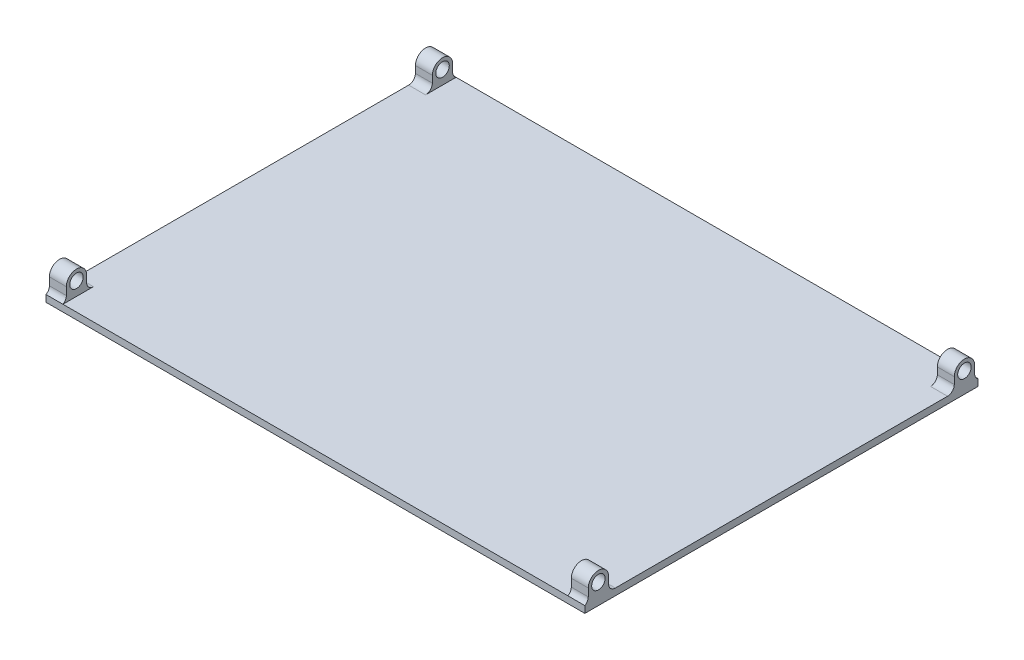
from build123d import *

# Parameters (mm, degrees)
SKETCH_1_W          = 159
SKETCH_1_H          = 116
EXTRUDE_1_DEPTH     = 2
SKETCH_3_R          = 1.99
EXTRUDE_3_DEPTH     = 79.5
SKETCH_4_W          = 149
SKETCH_4_H          = 7
CUT_EXTRUDE_2_DEPTH = 79.5
FILLET_3_R          = 2


with BuildPart() as part:
    # 草图1 → 凸台-拉伸1 (new body)
    with BuildSketch(Plane(origin=(0, 0, 0), x_dir=(1, 0, 0), z_dir=(0, 1, 0))):
        Rectangle(SKETCH_1_W, SKETCH_1_H)
    extrude(amount=EXTRUDE_1_DEPTH)

    # 草图3 → 凸台-拉伸3 (add, symmetric)
    # profile 1 of 2: a face of its own
    with BuildSketch(Plane(origin=(0, 0, 0), x_dir=(0, 0, -1), z_dir=(1, 0, 0))):
        with BuildLine():
            Line((-57, 6), (-57, 2))
            Line((-57, 2), (-51, 2))
            Line((-51, 2), (-51, 6))
            ThreePointArc((-51, 6), (-54, 9), (-57, 6))
        make_face()
        with Locations(Location((-54, 6, 0), (0, 0, 180))):
            Circle(SKETCH_3_R, mode=Mode.SUBTRACT)
    # profile 2 of 2: a face of its own
    with BuildSketch(Plane(origin=(0, 0, 0), x_dir=(0, 0, -1), z_dir=(1, 0, 0))):
        with BuildLine():
            Line((51, 2), (51, 6))
            ThreePointArc((51, 6), (54, 9), (57, 6))
            Line((57, 6), (57, 2))
            Line((57, 2), (51, 2))
        make_face()
        with Locations(Location((54, 6, 0), (0, 0, 180))):
            Circle(SKETCH_3_R, mode=Mode.SUBTRACT)
    extrude(amount=EXTRUDE_3_DEPTH, both=True)

    # 草图4 → 切除-拉伸2 (cut, symmetric)
    with BuildSketch(Plane.XY):
        with Locations((0, 5.5)):
            Rectangle(SKETCH_4_W, SKETCH_4_H)
    extrude(amount=CUT_EXTRUDE_2_DEPTH, both=True, mode=Mode.SUBTRACT)

    # 圆角3
    # the kernel refuses this fillet: 2 mm, written as the material it adds along each edge
    with BuildSketch(Plane(origin=(74.5, 2, 57), x_dir=(0, 1, 0), z_dir=(1, 0, 0))) as fillet_3_piece_1:
        with BuildLine():
            CenterArc((1.732050808, 2), FILLET_3_R, 210, 60)
            Line((0, 1), (-0.034641016, 0.98))
            ThreePointArc((-0.034641016, 0.98), (-0.04, 0.5), (-0.04, 0))
            Line((-0.04, 0), (0, -0.04))
            Line((0, -0.04), (1.732050808, -0.04))
            Line((1.732050808, -0.04), (1.732050808, 0))
        make_face()
    extrude(amount=5)
    with BuildSketch(Plane(origin=(74.5, 2, 51), x_dir=(0, 1, 0), z_dir=(1, 0, 0)), Plane(origin=(-79.5, 2, -51), x_dir=(0, 0, 1), z_dir=(1, 0, 0))) as fillet_3_piece_2:
        with BuildLine():
            CenterArc((FILLET_3_R, -FILLET_3_R), FILLET_3_R, 90, 90)
            Line((0, -FILLET_3_R), (-FILLET_3_R * 0.02, -FILLET_3_R))
            Line((-FILLET_3_R * 0.02, -FILLET_3_R), (-FILLET_3_R * 0.02, FILLET_3_R * 0.02))
            Line((-FILLET_3_R * 0.02, FILLET_3_R * 0.02), (FILLET_3_R, FILLET_3_R * 0.02))
            Line((FILLET_3_R, FILLET_3_R * 0.02), (FILLET_3_R, 0))
        make_face()
    extrude(amount=5)
    with BuildSketch(Plane(origin=(74.5, 2, -51), x_dir=(0, 1, 0), z_dir=(1, 0, 0)), Plane(origin=(-79.5, 2, 51), x_dir=(0, 0, -1), z_dir=(1, 0, 0))) as fillet_3_piece_3:
        with BuildLine():
            CenterArc((FILLET_3_R, FILLET_3_R), FILLET_3_R, 180, 90)
            Line((0, FILLET_3_R), (-FILLET_3_R * 0.02, FILLET_3_R))
            Line((-FILLET_3_R * 0.02, FILLET_3_R), (-FILLET_3_R * 0.02, -FILLET_3_R * 0.02))
            Line((-FILLET_3_R * 0.02, -FILLET_3_R * 0.02), (FILLET_3_R, -FILLET_3_R * 0.02))
            Line((FILLET_3_R, -FILLET_3_R * 0.02), (FILLET_3_R, 0))
        make_face()
    extrude(amount=5)
    with BuildSketch(Plane(origin=(74.5, 2, -57), x_dir=(0, 1, 0), z_dir=(1, 0, 0))) as fillet_3_piece_4:
        with BuildLine():
            CenterArc((1.732050808, -2), FILLET_3_R, 90, 60)
            Line((0, -1), (-0.034641016, -0.98))
            ThreePointArc((-0.034641016, -0.98), (-0.04, -0.5), (-0.04, 0))
            Line((-0.04, 0), (0, 0.04))
            Line((0, 0.04), (1.732050808, 0.04))
            Line((1.732050808, 0.04), (1.732050808, 0))
        make_face()
    extrude(amount=5)
    with BuildSketch(Plane(origin=(-79.5, 2, -57), x_dir=(0, 0, -1), z_dir=(1, 0, 0))) as fillet_3_piece_5:
        with BuildLine():
            CenterArc((2, 1.732050808), FILLET_3_R, 180, 60)
            Line((0, 1.732050808), (-0.04, 1.732050808))
            Line((-0.04, 1.732050808), (-0.04, 0))
            Line((-0.04, 0), (0, -0.04))
            ThreePointArc((0, -0.04), (0.5, -0.04), (0.98, -0.034641016))
            Line((0.98, -0.034641016), (1, 0))
        make_face()
    extrude(amount=5)
    with BuildSketch(Plane(origin=(-79.5, 2, 57), x_dir=(0, 0, 1), z_dir=(1, 0, 0))) as fillet_3_piece_6:
        with BuildLine():
            CenterArc((2, -1.732050808), FILLET_3_R, 120, 60)
            Line((0, -1.732050808), (-0.04, -1.732050808))
            Line((-0.04, -1.732050808), (-0.04, 0))
            Line((-0.04, 0), (0, 0.04))
            ThreePointArc((0, 0.04), (0.5, 0.04), (0.98, 0.034641016))
            Line((0.98, 0.034641016), (1, 0))
        make_face()
    extrude(amount=5)


solid = part.part
